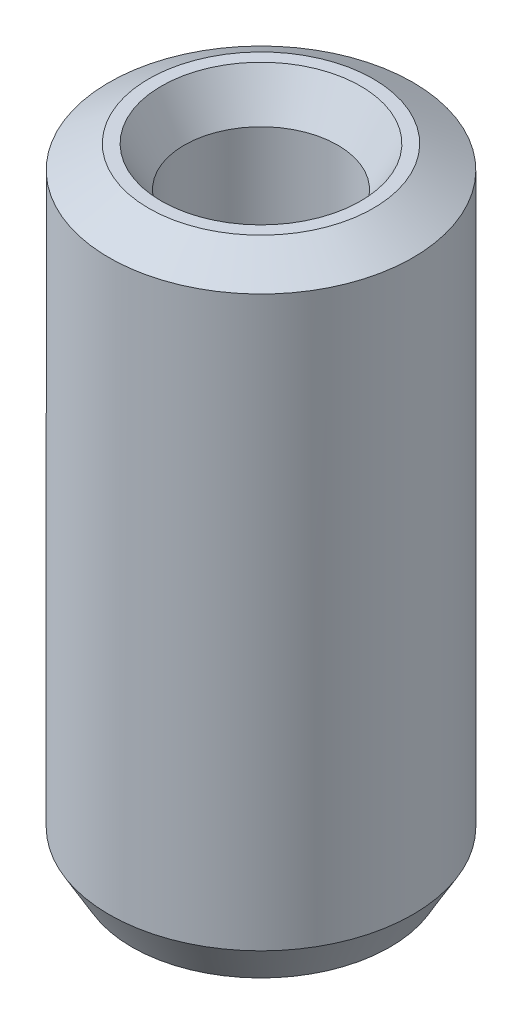
from build123d import *
from OCP.BRepFilletAPI import BRepFilletAPI_MakeChamfer

# Parameters (mm, degrees)
SKETCH1_R           = 15
BOSS_EXTRUDE1_DEPTH = 62.351916928
SKETCH2_R           = 7.577503125
CUT_EXTRUDE1_DEPTH  = 66.861684951
CHAMFER1_SIZE       = 2.262327299
CHAMFER1_SIZE2      = 3.918465825


with BuildPart() as part:
    # Sketch1 → Boss-Extrude1 (new body)
    with BuildSketch(Plane(origin=(0, 0, 0), x_dir=(1, 0, 0), z_dir=(0, 1, 0))):
        Circle(SKETCH1_R)
    extrude(amount=BOSS_EXTRUDE1_DEPTH)

    # Sketch2 → Cut-Extrude1 (cut, through all)
    with BuildSketch(Plane(origin=(0, 0, 0), x_dir=(1, 0, 0), z_dir=(0, 1, 0))):
        Circle(SKETCH2_R)
    extrude(amount=CUT_EXTRUDE1_DEPTH, mode=Mode.SUBTRACT)

    # Chamfer1: one chamfer whose edges measure the first distance from different faces: ONE call of the kernel's chamfer builder (chamfer() names one face for all edges)
    chamfer1_edges_1 = [part.edges().sort_by_distance(p)[0] for p in [
        (-7.577503125, 62.351916928, 0),
    ]]
    chamfer1_side_1 = [part.faces().sort_by_distance(p)[0] for p in [
        (-14.575735931, 62.351916928, 0),
    ]]
    chamfer1_edges_2 = [part.edges().sort_by_distance(p)[0] for p in [
        (-7.577503125, 0, 0),
    ]]
    chamfer1_side_2 = [part.faces().sort_by_distance(p)[0] for p in [
        (-7.577503125, 31.175958464, 0),
    ]]
    chamfer1_edges_3 = [part.edges().sort_by_distance(p)[0] for p in [
        (-15, 0, 0),
    ]]
    chamfer1_side_3 = [part.faces().sort_by_distance(p)[0] for p in [
        (-14.575735931, 0, 0),
    ]]
    chamfer1_edges_4 = [part.edges().sort_by_distance(p)[0] for p in [
        (-15, 62.351916928, 0),
    ]]
    chamfer1_side_4 = [part.faces().sort_by_distance(p)[0] for p in [
        (-15, 31.175958464, 0),
    ]]
    chamfer1 = BRepFilletAPI_MakeChamfer(part.part.solid().wrapped)
    for e in chamfer1_edges_1:
        chamfer1.Add(CHAMFER1_SIZE, CHAMFER1_SIZE2, e.wrapped, chamfer1_side_1[0].wrapped)  # the first distance lies on this face
    for e in chamfer1_edges_2:
        chamfer1.Add(CHAMFER1_SIZE, CHAMFER1_SIZE2, e.wrapped, chamfer1_side_2[0].wrapped)  # the first distance lies on this face
    for e in chamfer1_edges_3:
        chamfer1.Add(CHAMFER1_SIZE, CHAMFER1_SIZE2, e.wrapped, chamfer1_side_3[0].wrapped)  # the first distance lies on this face
    for e in chamfer1_edges_4:
        chamfer1.Add(CHAMFER1_SIZE, CHAMFER1_SIZE2, e.wrapped, chamfer1_side_4[0].wrapped)  # the first distance lies on this face
    add(Compound.cast(chamfer1.Shape()), mode=Mode.REPLACE)


solid = part.part
